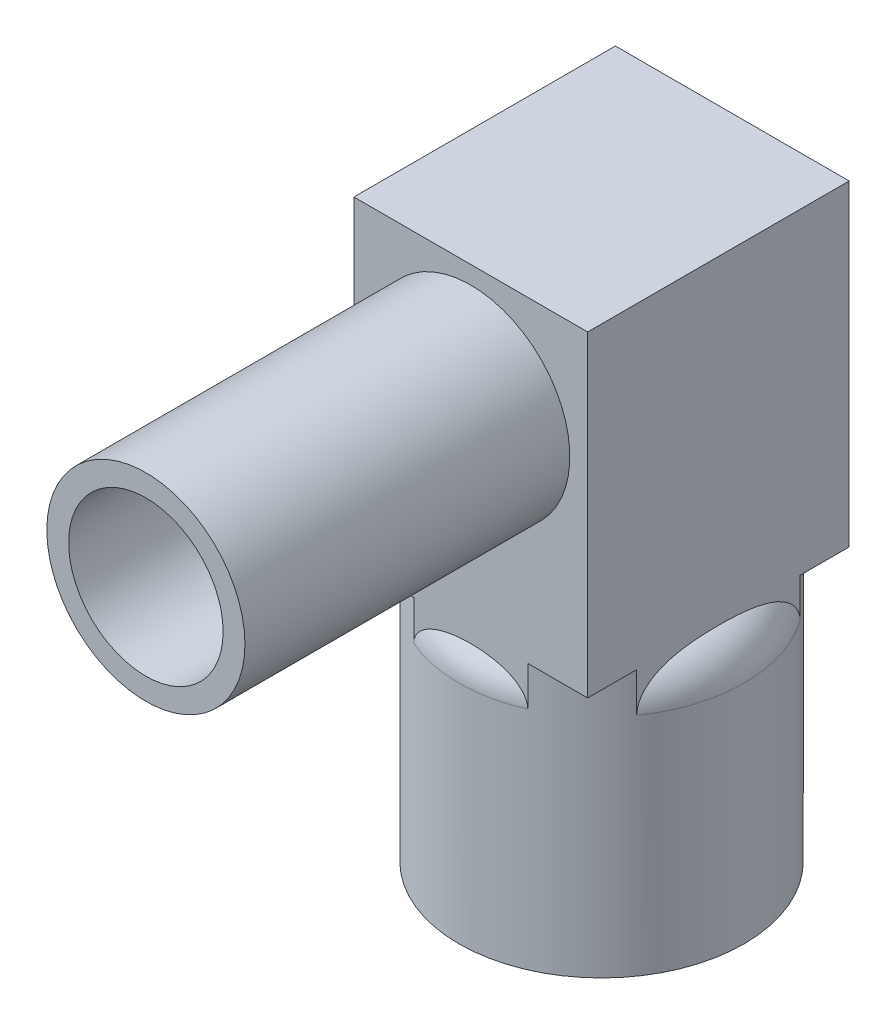
from build123d import *

# Parameters (mm, degrees)
SKETCH1_R           = 9.144
BOSS_EXTRUDE1_DEPTH = 17.018
SKETCH2_W           = 14.986
SKETCH2_H           = 16.764
BOSS_EXTRUDE2_DEPTH = 20.32
SKETCH3_R           = 6.35
BOSS_EXTRUDE3_DEPTH = 20.828
SKETCH5_R           = 4.953
CUT_EXTRUDE1_DEPTH  = 25.4
SKETCH6_R           = 6.985
CUT_EXTRUDE2_DEPTH  = 35.56
FILLET3_R           = 2.54


with BuildPart() as part:
    # Sketch1 → Boss-Extrude1 (new body)
    with BuildSketch(Plane(origin=(0, 0, 0), x_dir=(1, 0, 0), z_dir=(0, 1, 0))):
        with Locations(Location((-13.844609685, 2.253750912, 0), (0, 0, 270))):
            Circle(SKETCH1_R)
    extrude(amount=BOSS_EXTRUDE1_DEPTH)

    # Sketch2 → Boss-Extrude2 (add)
    with BuildSketch(Plane(origin=(0, 17.018, 0), x_dir=(1, 0, 0), z_dir=(0, 1, 0))):
        with Locations((-13.844609685, 2.253750912)):
            Rectangle(SKETCH2_W, SKETCH2_H)
    extrude(amount=BOSS_EXTRUDE2_DEPTH)

    # Sketch3 → Boss-Extrude3 (add)
    with BuildSketch(Plane.XY.offset(6.128249088)):
        with Locations(Location((-13.844609685, 29.845, 0), (0, 0, 180))):
            Circle(SKETCH3_R)
    extrude(amount=BOSS_EXTRUDE3_DEPTH)

    # Sketch5 → Cut-Extrude1 (cut)
    with BuildSketch(Plane.XY.offset(26.956249088)):
        with Locations((-13.844609685, 29.845)):
            Circle(SKETCH5_R)
    extrude(amount=-CUT_EXTRUDE1_DEPTH, mode=Mode.SUBTRACT)

    # Sketch6 → Cut-Extrude2 (cut)
    with BuildSketch(Plane.XZ):
        with Locations(Location((-13.947920493, -2.516662253, 0), (0, 0, 270))):
            Circle(SKETCH6_R)
    extrude(amount=-CUT_EXTRUDE2_DEPTH, mode=Mode.SUBTRACT)

    # Fillet3
    # the kernel refuses this fillet: 2.54 mm, written as the material it takes off along each edge
    with BuildSketch(Plane(origin=(-13.844609685, 17.018, -2.253750912), x_dir=(-0.2627084277127984, 0, -0.9648752675909303), z_dir=(0.9648752675909303, 0, -0.2627084277127984))) as fillet3_piece_1_section:
        with BuildLine():
            CenterArc((9.144 - FILLET3_R, -FILLET3_R), FILLET3_R, 0, 90)
            Line((9.144 - FILLET3_R, 0), (9.144, 0))
            Line((9.144, 0), (9.144, -FILLET3_R))
        make_face()
    fillet3_piece_1 = revolve(axis=Axis((-13.844609685, 17.018, -2.253750912), (0, 1, 0)), revolution_arc=149.538336895, mode=Mode.PRIVATE)
    fillet3_piece_1 = split(fillet3_piece_1, bisect_by=Plane(origin=(-16.671949394, 16.123690595, -10.635750912), z_dir=(0, 0, -1)), keep=Keep.TOP, mode=Mode.PRIVATE)
    add(fillet3_piece_1, mode=Mode.SUBTRACT)
    with BuildSketch(Plane(origin=(-13.844609685, 17.018, -2.253750912), x_dir=(-0.2627084277127984, 0, -0.9648752675909303), z_dir=(0.9648752675909303, 0, -0.2627084277127984))) as fillet3_piece_2_section:
        with BuildLine():
            CenterArc((9.144 - FILLET3_R, -FILLET3_R), FILLET3_R, 0, 90)
            Line((9.144 - FILLET3_R, 0), (9.144, 0))
            Line((9.144, 0), (9.144, -FILLET3_R))
        make_face()
    fillet3_piece_2 = revolve(axis=Axis((-13.844609685, 17.018, -2.253750912), (0, 1, 0)), revolution_arc=149.538336895, mode=Mode.PRIVATE)
    fillet3_piece_2 = split(fillet3_piece_2, bisect_by=Plane(origin=(-16.671949372, 16.123690833, 6.128249088), z_dir=(0, 0, 1)), keep=Keep.TOP, mode=Mode.PRIVATE)
    add(fillet3_piece_2, mode=Mode.SUBTRACT)
    with BuildSketch(Plane(origin=(-13.844609685, 17.018, -2.253750912), x_dir=(-0.2627084277127984, 0, -0.9648752675909303), z_dir=(0.9648752675909303, 0, -0.2627084277127984))) as fillet3_piece_3_section:
        with BuildLine():
            CenterArc((9.144 - FILLET3_R, -FILLET3_R), FILLET3_R, 0, 90)
            Line((9.144 - FILLET3_R, 0), (9.144, 0))
            Line((9.144, 0), (9.144, -FILLET3_R))
        make_face()
    fillet3_piece_3 = revolve(axis=Axis((-13.844609685, 17.018, -2.253750912), (0, 1, 0)), revolution_arc=149.538336895, mode=Mode.PRIVATE)
    fillet3_piece_3 = split(fillet3_piece_3, bisect_by=Plane(origin=(-21.337609685, 16.368354177, -2.253748905), z_dir=(-1, 0, 0)), keep=Keep.TOP, mode=Mode.PRIVATE)
    add(fillet3_piece_3, mode=Mode.SUBTRACT)
    with BuildSketch(Plane(origin=(-13.844609685, 17.018, -2.253750912), x_dir=(-0.8937341447307489, 0, 0.4485970112945439), z_dir=(-0.4485970112945439, 0, -0.8937341447307489))) as fillet3_piece_4_section:
        with BuildLine():
            CenterArc((9.144 - FILLET3_R, -FILLET3_R), FILLET3_R, 0, 90)
            Line((9.144 - FILLET3_R, 0), (9.144, 0))
            Line((9.144, 0), (9.144, -FILLET3_R))
        make_face()
    fillet3_piece_4 = revolve(axis=Axis((-13.844609685, 17.018, -2.253750912), (0, 1, 0)), revolution_arc=63.346294775, mode=Mode.PRIVATE)
    fillet3_piece_4 = split(fillet3_piece_4, bisect_by=Plane(origin=(-21.337609685, 16.206370087, 2.181832168), z_dir=(-1, 0, 0)), keep=Keep.TOP, mode=Mode.PRIVATE)
    add(fillet3_piece_4, mode=Mode.SUBTRACT)
    with BuildSketch(Plane(origin=(-13.844609685, 17.018, -2.253750912), x_dir=(-0.8937341447307489, 0, 0.4485970112945439), z_dir=(-0.4485970112945439, 0, -0.8937341447307489))) as fillet3_piece_5_section:
        with BuildLine():
            CenterArc((9.144 - FILLET3_R, -FILLET3_R), FILLET3_R, 0, 90)
            Line((9.144 - FILLET3_R, 0), (9.144, 0))
            Line((9.144, 0), (9.144, -FILLET3_R))
        make_face()
    fillet3_piece_5 = revolve(axis=Axis((-13.844609685, 17.018, -2.253750912), (0, 1, 0)), revolution_arc=63.346294775, mode=Mode.PRIVATE)
    fillet3_piece_5 = split(fillet3_piece_5, bisect_by=Plane(origin=(-15.321370262, 16.241743505, 6.128249088), z_dir=(0, 0, 1)), keep=Keep.TOP, mode=Mode.PRIVATE)
    add(fillet3_piece_5, mode=Mode.SUBTRACT)
    with BuildSketch(Plane(origin=(-13.844609685, 17.018, -2.253750912), x_dir=(0.8937598579171911, 0, -0.4485457795764468), z_dir=(0.4485457795764468, 0, 0.8937598579171911))) as fillet3_piece_6_section:
        with BuildLine():
            CenterArc((9.144 - FILLET3_R, -FILLET3_R), FILLET3_R, 0, 90)
            Line((9.144 - FILLET3_R, 0), (9.144, 0))
            Line((9.144, 0), (9.144, -FILLET3_R))
        make_face()
    fillet3_piece_6 = revolve(axis=Axis((-13.844609685, 17.018, -2.253750912), (0, 1, 0)), revolution_arc=126.699158212, mode=Mode.PRIVATE)
    fillet3_piece_6 = split(fillet3_piece_6, bisect_by=Plane(origin=(-6.351609685, 16.206428058, -6.689039599), z_dir=(1, 0, 0)), keep=Keep.TOP, mode=Mode.PRIVATE)
    add(fillet3_piece_6, mode=Mode.SUBTRACT)
    with BuildSketch(Plane(origin=(-13.844609685, 17.018, -2.253750912), x_dir=(0.8937598579171911, 0, -0.4485457795764468), z_dir=(0.4485457795764468, 0, 0.8937598579171911))) as fillet3_piece_7_section:
        with BuildLine():
            CenterArc((9.144 - FILLET3_R, -FILLET3_R), FILLET3_R, 0, 90)
            Line((9.144 - FILLET3_R, 0), (9.144, 0))
            Line((9.144, 0), (9.144, -FILLET3_R))
        make_face()
    fillet3_piece_7 = revolve(axis=Axis((-13.844609685, 17.018, -2.253750912), (0, 1, 0)), revolution_arc=126.699158212, mode=Mode.PRIVATE)
    fillet3_piece_7 = split(fillet3_piece_7, bisect_by=Plane(origin=(-21.337609685, 16.206428241, -6.68903958), z_dir=(-1, 0, 0)), keep=Keep.TOP, mode=Mode.PRIVATE)
    add(fillet3_piece_7, mode=Mode.SUBTRACT)
    with BuildSketch(Plane(origin=(-13.844609685, 17.018, -2.253750912), x_dir=(0.8937598579171911, 0, -0.4485457795764468), z_dir=(0.4485457795764468, 0, 0.8937598579171911))) as fillet3_piece_8_section:
        with BuildLine():
            CenterArc((9.144 - FILLET3_R, -FILLET3_R), FILLET3_R, 0, 90)
            Line((9.144 - FILLET3_R, 0), (9.144, 0))
            Line((9.144, 0), (9.144, -FILLET3_R))
        make_face()
    fillet3_piece_8 = revolve(axis=Axis((-13.844609685, 17.018, -2.253750912), (0, 1, 0)), revolution_arc=126.699158212, mode=Mode.PRIVATE)
    fillet3_piece_8 = split(fillet3_piece_8, bisect_by=Plane(origin=(-13.844610271, 16.241742489, -10.635750912), z_dir=(0, 0, -1)), keep=Keep.TOP, mode=Mode.PRIVATE)
    add(fillet3_piece_8, mode=Mode.SUBTRACT)
    with BuildSketch(Plane(origin=(-13.844609685, 17.018, -2.253750912), x_dir=(0.26270842771276587, 0, 0.9648752675909392), z_dir=(-0.9648752675909392, 0, 0.26270842771276587))) as fillet3_piece_9_section:
        with BuildLine():
            CenterArc((9.144 - FILLET3_R, -FILLET3_R), FILLET3_R, 0, 90)
            Line((9.144 - FILLET3_R, 0), (9.144, 0))
            Line((9.144, 0), (9.144, -FILLET3_R))
        make_face()
    fillet3_piece_9 = revolve(axis=Axis((-13.844609685, 17.018, -2.253750912), (0, 1, 0)), revolution_arc=149.538336895, mode=Mode.PRIVATE)
    fillet3_piece_9 = split(fillet3_piece_9, bisect_by=Plane(origin=(-11.017269976, 16.123690595, 6.128249088), z_dir=(0, 0, 1)), keep=Keep.TOP, mode=Mode.PRIVATE)
    add(fillet3_piece_9, mode=Mode.SUBTRACT)
    with BuildSketch(Plane(origin=(-13.844609685, 17.018, -2.253750912), x_dir=(0.26270842771276587, 0, 0.9648752675909392), z_dir=(-0.9648752675909392, 0, 0.26270842771276587))) as fillet3_piece_10_section:
        with BuildLine():
            CenterArc((9.144 - FILLET3_R, -FILLET3_R), FILLET3_R, 0, 90)
            Line((9.144 - FILLET3_R, 0), (9.144, 0))
            Line((9.144, 0), (9.144, -FILLET3_R))
        make_face()
    fillet3_piece_10 = revolve(axis=Axis((-13.844609685, 17.018, -2.253750912), (0, 1, 0)), revolution_arc=149.538336895, mode=Mode.PRIVATE)
    fillet3_piece_10 = split(fillet3_piece_10, bisect_by=Plane(origin=(-11.017269998, 16.123690833, -10.635750912), z_dir=(0, 0, -1)), keep=Keep.TOP, mode=Mode.PRIVATE)
    add(fillet3_piece_10, mode=Mode.SUBTRACT)
    with BuildSketch(Plane(origin=(-13.844609685, 17.018, -2.253750912), x_dir=(0.26270842771276587, 0, 0.9648752675909392), z_dir=(-0.9648752675909392, 0, 0.26270842771276587))) as fillet3_piece_11_section:
        with BuildLine():
            CenterArc((9.144 - FILLET3_R, -FILLET3_R), FILLET3_R, 0, 90)
            Line((9.144 - FILLET3_R, 0), (9.144, 0))
            Line((9.144, 0), (9.144, -FILLET3_R))
        make_face()
    fillet3_piece_11 = revolve(axis=Axis((-13.844609685, 17.018, -2.253750912), (0, 1, 0)), revolution_arc=149.538336895, mode=Mode.PRIVATE)
    fillet3_piece_11 = split(fillet3_piece_11, bisect_by=Plane(origin=(-6.351609685, 16.368354177, -2.253752919), z_dir=(1, 0, 0)), keep=Keep.TOP, mode=Mode.PRIVATE)
    add(fillet3_piece_11, mode=Mode.SUBTRACT)
    with BuildSketch(Plane(origin=(-13.844609685, 17.018, -2.253750912), x_dir=(0, 0, 1), z_dir=(-1, 0, 0))) as fillet3_piece_12_section:
        with BuildLine():
            CenterArc((9.144 - FILLET3_R, -FILLET3_R), FILLET3_R, 0, 90)
            Line((9.144 - FILLET3_R, 0), (9.144, 0))
            Line((9.144, 0), (9.144, -FILLET3_R))
        make_face()
    fillet3_piece_12 = revolve(axis=Axis((-13.844609685, 17.018, -2.253750912), (0, 1, 0)), revolution_arc=63.346294775, mode=Mode.PRIVATE)
    fillet3_piece_12 = split(fillet3_piece_12, bisect_by=Plane(origin=(-12.367849263, 16.241743644, 6.128249088), z_dir=(0, 0, 1)), keep=Keep.TOP, mode=Mode.PRIVATE)
    add(fillet3_piece_12, mode=Mode.SUBTRACT)
    with BuildSketch(Plane(origin=(-13.844609685, 17.018, -2.253750912), x_dir=(0, 0, 1), z_dir=(-1, 0, 0))) as fillet3_piece_13_section:
        with BuildLine():
            CenterArc((9.144 - FILLET3_R, -FILLET3_R), FILLET3_R, 0, 90)
            Line((9.144 - FILLET3_R, 0), (9.144, 0))
            Line((9.144, 0), (9.144, -FILLET3_R))
        make_face()
    fillet3_piece_13 = revolve(axis=Axis((-13.844609685, 17.018, -2.253750912), (0, 1, 0)), revolution_arc=63.346294775, mode=Mode.PRIVATE)
    fillet3_piece_13 = split(fillet3_piece_13, bisect_by=Plane(origin=(-6.351609685, 16.20637027, 2.181832149), z_dir=(1, 0, 0)), keep=Keep.TOP, mode=Mode.PRIVATE)
    add(fillet3_piece_13, mode=Mode.SUBTRACT)


solid = part.part
